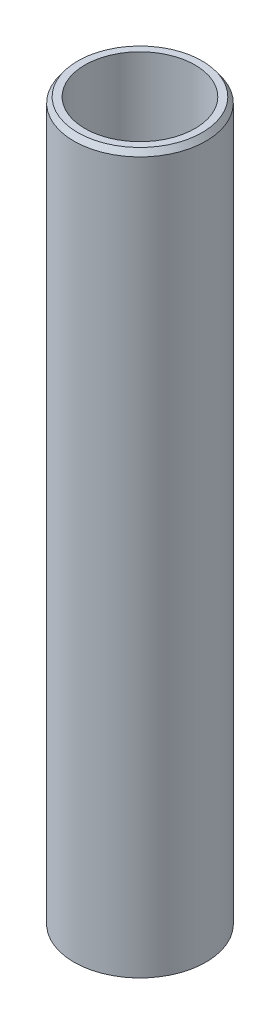
from build123d import *
from OCP.BRepFilletAPI import BRepFilletAPI_MakeChamfer

# Parameters (mm, degrees)
SKETCH1_R           = 55
BOSS_EXTRUDE1_DEPTH = 600
SKETCH2_R           = 45.876505887
CUT_EXTRUDE1_DEPTH  = 606.020660804
CHAMFER1_SIZE       = 4.534968911
CHAMFER1_SIZE2      = 3.237671035


with BuildPart() as part:
    # Sketch1 → Boss-Extrude1 (new body)
    with BuildSketch(Plane(origin=(0, 0, 0), x_dir=(1, 0, 0), z_dir=(0, 1, 0))):
        Circle(SKETCH1_R)
    extrude(amount=BOSS_EXTRUDE1_DEPTH)

    # Sketch2 → Cut-Extrude1 (cut, through all)
    with BuildSketch(Plane(origin=(0, 0, 0), x_dir=(1, 0, 0), z_dir=(0, 1, 0))):
        Circle(SKETCH2_R)
    extrude(amount=CUT_EXTRUDE1_DEPTH, mode=Mode.SUBTRACT)

    # Chamfer1: one chamfer whose edges measure the first distance from different faces: ONE call of the kernel's chamfer builder (chamfer() names one face for all edges)
    chamfer1_edges_1 = [part.edges().sort_by_distance(p)[0] for p in [
        (-55, 600, 0),
    ]]
    chamfer1_side_1 = [part.faces().sort_by_distance(p)[0] for p in [
        (-55, 300, 0),
    ]]
    chamfer1_edges_2 = [part.edges().sort_by_distance(p)[0] for p in [
        (-55, 0, 0),
    ]]
    chamfer1_side_2 = [part.faces().sort_by_distance(p)[0] for p in [
        (-53.444365081, 0, 0),
    ]]
    chamfer1 = BRepFilletAPI_MakeChamfer(part.part.solid().wrapped)
    for e in chamfer1_edges_1:
        chamfer1.Add(CHAMFER1_SIZE, CHAMFER1_SIZE2, e.wrapped, chamfer1_side_1[0].wrapped)  # the first distance lies on this face
    for e in chamfer1_edges_2:
        chamfer1.Add(CHAMFER1_SIZE, CHAMFER1_SIZE2, e.wrapped, chamfer1_side_2[0].wrapped)  # the first distance lies on this face
    add(Compound.cast(chamfer1.Shape()), mode=Mode.REPLACE)


solid = part.part
